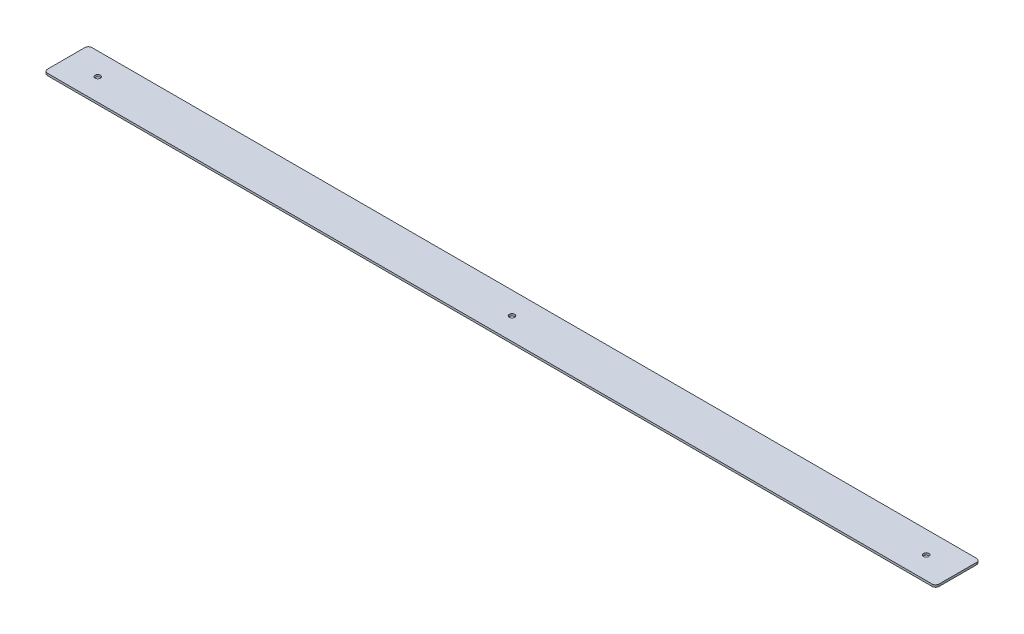
from build123d import *

# Parameters (mm, degrees)
SKETCH1_W           = 636.566333418
SKETCH1_H           = 31.75
BOSS_EXTRUDE1_DEPTH = 1.524
SKETCH2_R           = 1.905
CUT_EXTRUDE1_DEPTH  = 319.682463294
FILLET1_R           = 2.54


with BuildPart() as part:
    # Sketch1 → Boss-Extrude1 (new body)
    with BuildSketch(Plane(origin=(0, 0, 0), x_dir=(1, 0, 0), z_dir=(0, 1, 0))):
        Rectangle(SKETCH1_W, SKETCH1_H)
    extrude(amount=BOSS_EXTRUDE1_DEPTH)

    # Sketch2 → Cut-Extrude1 (cut, through all)
    with BuildSketch(Plane(origin=(0, 1.524, 0), x_dir=(1, 0, 0), z_dir=(0, 1, 0))):
        with Locations((-295.698333291, 0)):
            Circle(SKETCH2_R)
        with Locations((295.698333291, 0)):
            Circle(SKETCH2_R)
        Circle(SKETCH2_R)
    extrude(amount=-CUT_EXTRUDE1_DEPTH, mode=Mode.SUBTRACT)

    # Fillet1
    fillet1_edges = [part.edges().sort_by_distance(p)[0] for p in [
        (318.283166709, 0.762, 15.875),
        (318.283166709, 0.762, -15.875),
        (-318.283166709, 0.762, 15.875),
        (-318.283166709, 0.762, -15.875),
    ]]
    fillet(fillet1_edges, radius=FILLET1_R)


solid = part.part
